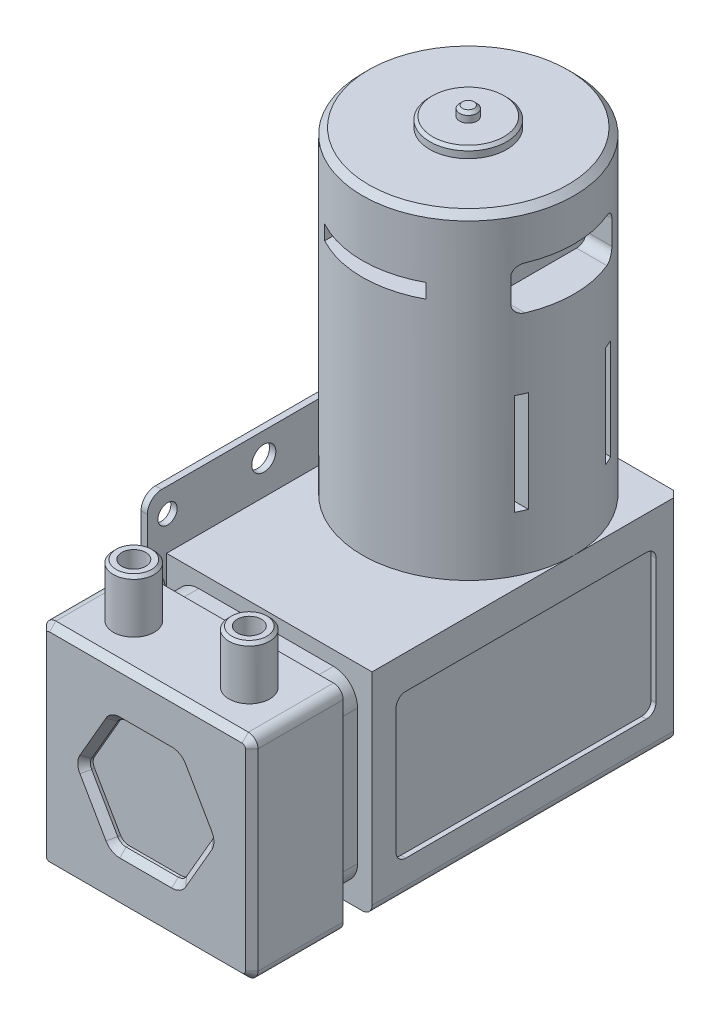
from build123d import *

# Parameters (mm, degrees)
SKETCH_1_W           = 89
SKETCH_1_H           = 44
EXTRUDE_1_DEPTH      = 44
SKETCH_2_R           = 22
EXTRUDE_2_DEPTH      = 66
SKETCH_3_OUTSIDE_W   = 75.636
SKETCH_3_OUTSIDE_H   = 141.636
SKETCH_3_OUTSIDE_W_2 = 38
SKETCH_3_OUTSIDE_H_2 = 38
CUT_EXTRUDE_1_DEPTH  = 6
SKETCH_4_W           = 21
SKETCH_4_H           = 9
SKETCH_4_W_2         = 2
SKETCH_4_H_2         = 21
CUT_EXTRUDE_2_DEPTH  = 8
SKETCH_5_R           = 8
EXTRUDE_3_DEPTH      = 2
SKETCH_6_R           = 1.8
EXTRUDE_4_DEPTH      = 2
SKETCH_7_R           = 4.25
SKETCH_7_R_2         = 2.5
EXTRUDE_5_DEPTH      = 11
SKETCH_8_W           = 54
SKETCH_8_H           = 30
CUT_EXTRUDE_3_DEPTH  = 1
CUT_EXTRUDE_4_DEPTH  = 1.888
SKETCH_10_W          = 21
SKETCH_10_H          = 3
CUT_EXTRUDE_5_DEPTH  = 6
SKETCH_11_W          = 27
SKETCH_11_H          = 22
CUT_EXTRUDE_6_DEPTH  = 1.234
FILLET_1_R           = 5
FILLET_2_R           = 2
CHAMFER_1_SIZE       = 0.6
CHAMFER_2_SIZE       = 1.314
FILLET_3_R           = 2
CHAMFER_3_SIZE       = 1.314
CHAMFER_4_SIZE       = 0.6
SKETCH_12_W          = 46
SKETCH_12_H          = 12
EXTRUDE_6_DEPTH      = 1.314
CUT_EXTRUDE_7_REACH  = 113.267
SKETCH_13_R          = 2
SKETCH_13_R_2        = 2.5
FILLET_4_R           = 10
FILLET_5_R           = 3


with BuildPart() as part:
    # 草图1 → 凸台-拉伸1 (new body)
    with BuildSketch(Plane(origin=(0, 0, 0), x_dir=(0, 0, -1), z_dir=(1, 0, 0))):
        Rectangle(SKETCH_1_W, SKETCH_1_H)
    extrude(amount=EXTRUDE_1_DEPTH)

    # 草图2 → 凸台-拉伸2 (add)
    with BuildSketch(Plane(origin=(0, 22, 0), x_dir=(1, 0, 0), z_dir=(0, 1, 0))):
        with Locations(Location((22, 22.5, 0), (0, 0, 90))):
            Circle(SKETCH_2_R)
    extrude(amount=EXTRUDE_2_DEPTH)

    # 草图3 outside → 切除-拉伸1 (cut)
    with BuildSketch(Plane.XY.offset(25.5)):
        with Locations((22, 33)):
            Rectangle(SKETCH_3_OUTSIDE_W, SKETCH_3_OUTSIDE_H)
        with Locations((22, 0)):
            Rectangle(SKETCH_3_OUTSIDE_W_2, SKETCH_3_OUTSIDE_H_2, mode=Mode.SUBTRACT)
    extrude(amount=-CUT_EXTRUDE_1_DEPTH, mode=Mode.SUBTRACT)

    # 草图4 → 切除-拉伸2 (cut)
    with BuildSketch(Plane(origin=(44, 0, 0), x_dir=(0, 0, -1), z_dir=(1, 0, 0))):
        with Locations((22.5, 73.5)):
            Rectangle(SKETCH_4_W, SKETCH_4_H)
        with Locations((13.5, 44)):
            Rectangle(SKETCH_4_W_2, SKETCH_4_H_2)
        with Locations((31.5, 44)):
            Rectangle(SKETCH_4_W_2, SKETCH_4_H_2)
    cut_extrude_2 = extrude(amount=-CUT_EXTRUDE_2_DEPTH, mode=Mode.SUBTRACT)

    # 镜向1: 切除-拉伸2 across plane
    add(cut_extrude_2.mirror(Plane(origin=(22, 0, 0), x_dir=(0, 0, 1), z_dir=(1, 0, 0))), mode=Mode.SUBTRACT)

    # 草图5 → 凸台-拉伸3 (add)
    with BuildSketch(Plane(origin=(0, 88, 0), x_dir=(1, 0, 0), z_dir=(0, 1, 0))):
        with Locations(Location((22, 22.5, 0), (0, 0, 270))):
            Circle(SKETCH_5_R)
    extrude(amount=EXTRUDE_3_DEPTH)

    # 草图6 → 凸台-拉伸4 (add)
    with BuildSketch(Plane(origin=(0, 90, 0), x_dir=(1, 0, 0), z_dir=(0, 1, 0))):
        with Locations(Location((22, 22.5, 0), (0, 0, 270))):
            Circle(SKETCH_6_R)
    extrude(amount=EXTRUDE_4_DEPTH)

    # 草图7 → 凸台-拉伸5 (add)
    with BuildSketch(Plane(origin=(0, 22, 0), x_dir=(1, 0, 0), z_dir=(0, 1, 0))):
        with Locations(Location((34, -35, 0), (0, 0, 90))):
            Circle(SKETCH_7_R)
        with Locations(Location((34, -35, 0), (0, 0, 270))):
            Circle(SKETCH_7_R_2, mode=Mode.SUBTRACT)
    extrude_5 = extrude(amount=EXTRUDE_5_DEPTH)

    # 镜向2: 凸台-拉伸5 across plane
    add(extrude_5.mirror(Plane(origin=(22, 0, 0), x_dir=(0, 0, 1), z_dir=(1, 0, 0))))

    # 草图8 → 切除-拉伸3 (cut)
    with BuildSketch(Plane(origin=(44, 0, 0), x_dir=(0, 0, -1), z_dir=(1, 0, 0))):
        with Locations((12.5, 0)):
            Rectangle(SKETCH_8_W, SKETCH_8_H)
    cut_extrude_3 = extrude(amount=-CUT_EXTRUDE_3_DEPTH, mode=Mode.SUBTRACT)

    # 镜向3: 切除-拉伸3 across plane
    add(cut_extrude_3.mirror(Plane(origin=(22, 0, 0), x_dir=(0, 0, 1), z_dir=(1, 0, 0))), mode=Mode.SUBTRACT)

    # 草图9 → 切除-拉伸4 (cut)
    with BuildSketch(Plane(origin=(0, 0, -44.5), x_dir=(-1, 0, 0), z_dir=(0, 0, -1))):
        Polygon((-8.86, 0), (-15.43, 11.379573806), (-28.57, 11.379573806), (-35.14, 0), (-28.57, -11.379573806), (-15.43, -11.379573806), align=None)
    cut_extrude_4 = extrude(amount=-CUT_EXTRUDE_4_DEPTH, mode=Mode.SUBTRACT)

    # 镜向4: 切除-拉伸4 across plane
    add(cut_extrude_4.mirror(Plane.XY), mode=Mode.SUBTRACT)

    # 草图10 → 切除-拉伸5 (cut)
    with BuildSketch(Plane(origin=(0, 0, -44.5), x_dir=(-1, 0, 0), z_dir=(0, 0, -1))):
        with Locations((-22, 73.5)):
            Rectangle(SKETCH_10_W, SKETCH_10_H)
    cut_extrude_5 = extrude(amount=-CUT_EXTRUDE_5_DEPTH, mode=Mode.SUBTRACT)

    # 镜向5: 切除-拉伸5 across plane
    add(cut_extrude_5.mirror(Plane(origin=(0, 0, -22.5), x_dir=(1, 0, 0), z_dir=(0, 0, -1))), mode=Mode.SUBTRACT)

    # 草图11 → 切除-拉伸6 (cut)
    with BuildSketch(Plane(origin=(0, -22, 0), x_dir=(-1, 0, 0), z_dir=(0, -1, 0))):
        with Locations((-22, -2.5)):
            Rectangle(SKETCH_11_W, SKETCH_11_H)
        with Locations((-22, 27.5)):
            Rectangle(SKETCH_11_W, SKETCH_11_H)
    extrude(amount=-CUT_EXTRUDE_6_DEPTH, mode=Mode.SUBTRACT)

    # 圆角1
    fillet_1_edges = [part.edges().sort_by_distance(p)[0] for p in [
        (41, -19, 22.5),
        (3, -19, 22.5),
        (3, 19, 22.5),
        (41, 19, 22.5),
    ]]
    fillet(fillet_1_edges, radius=FILLET_1_R)

    # 圆角2
    fillet_2_edges = [part.edges().sort_by_distance(p)[0] for p in [
        (5.333692535, 69, -33),
        (5.333692535, 78, -33),
        (5.333692535, 78, -12),
        (5.333692535, 69, -12),
        (43.5, 15, -39.5),
        (43.5, -15, -39.5),
        (43.5, -15, 14.5),
        (43.5, 15, 14.5),
        (0.5, -15, -39.5),
        (0.5, 15, -39.5),
        (0.5, 15, 14.5),
        (0.5, -15, 14.5),
        (8.86, 0, -43.556),
        (15.43, -11.379573806, -43.556),
        (28.57, -11.379573806, -43.556),
        (35.14, 0, -43.556),
        (28.57, 11.379573806, -43.556),
        (15.43, 11.379573806, -43.556),
        (15.43, -11.379573806, 43.556),
        (8.86, 0, 43.556),
        (15.43, 11.379573806, 43.556),
        (28.57, 11.379573806, 43.556),
        (35.14, 0, 43.556),
        (28.57, -11.379573806, 43.556),
        (35.5, -21.383, 13.5),
        (35.5, -21.383, -8.5),
        (8.5, -21.383, -8.5),
        (8.5, -21.383, 13.5),
        (35.5, -21.383, -16.5),
        (35.5, -21.383, -38.5),
        (8.5, -21.383, -38.5),
        (8.5, -21.383, -16.5),
        (38.666307465, 78, -33),
        (38.666307465, 69, -33),
        (38.666307465, 69, -12),
        (38.666307465, 78, -12),
    ]]
    fillet(fillet_2_edges, radius=FILLET_2_R)

    # 倒角1
    chamfer_1_edges = [part.edges().sort_by_distance(p)[0] for p in [
        (34, 33, 39.25),
        (10, 33, 39.25),
    ]]
    chamfer(chamfer_1_edges, length=CHAMFER_1_SIZE)

    # 倒角2
    chamfer_2_edges = [part.edges().sort_by_distance(p)[0] for p in [
        (22, 88, -0.5),
    ]]
    chamfer(chamfer_2_edges, length=CHAMFER_2_SIZE)

    # 圆角3
    fillet_3_edges = [part.edges().sort_by_distance(p)[0] for p in [
        (44, -22, 35),
        (0, -22, -12.5),
        (0, 22, 35),
        (44, 22, 35),
        (44, -22, -12.5),
        (0, -22, 35),
    ]]
    fillet(fillet_3_edges, radius=FILLET_3_R)

    # 倒角3
    chamfer_3_edges = [part.edges().sort_by_distance(p)[0] for p in [
        (22, -11.379573806, 44.5),
        (12.145, -5.689786903, 44.5),
        (31.855, 5.689786903, 44.5),
        (31.855, -5.689786903, 44.5),
        (22, 11.379573806, 44.5),
        (12.145, 5.689786903, 44.5),
        (22, 11.379573806, -44.5),
        (12.145, 5.689786903, -44.5),
        (31.855, 5.689786903, -44.5),
        (31.855, -5.689786903, -44.5),
        (22, -11.379573806, -44.5),
        (12.145, -5.689786903, -44.5),
        (15.584700538, -11.111624613, 44.5),
        (34.830598923, 0, 44.5),
        (28.415299462, 11.111624613, 44.5),
        (15.584700538, 11.111624613, 44.5),
        (9.169401077, 0, 44.5),
        (28.415299462, -11.111624613, 44.5),
        (15.584700538, 11.111624613, -44.5),
        (28.415299462, 11.111624613, -44.5),
        (34.830598923, 0, -44.5),
        (28.415299462, -11.111624613, -44.5),
        (15.584700538, -11.111624613, -44.5),
        (9.169401077, 0, -44.5),
        (22, -22, -44.5),
        (0, 1, -44.5),
        (44, 1, -44.5),
        (43.414213562, -21.414213562, -44.5),
        (0.585786438, -21.414213562, -44.5),
        (22, 22, 44.5),
        (0, 0, 44.5),
        (22, -22, 44.5),
        (44, 0, 44.5),
        (43.414213562, 21.414213562, 44.5),
        (43.414213562, -21.414213562, 44.5),
        (0.585786438, -21.414213562, 44.5),
        (0.585786438, 21.414213562, 44.5),
    ]]
    chamfer(chamfer_3_edges, length=CHAMFER_3_SIZE)

    # 倒角4
    chamfer_4_edges = [part.edges().sort_by_distance(p)[0] for p in [
        (22, 90, -30.5),
        (22, 92, -24.3),
    ]]
    chamfer(chamfer_4_edges, length=CHAMFER_4_SIZE)

    # 草图12 → 凸台-拉伸6 (add)
    with BuildSketch(Plane.ZY):
        with Locations((0.5, 28)):
            Rectangle(SKETCH_12_W, SKETCH_12_H)
    extrude(amount=-EXTRUDE_6_DEPTH)

    # 草图13 → 切除-拉伸7 (cut, up to next)
    with BuildSketch(Plane.ZY, mode=Mode.PRIVATE) as cut_extrude_7_sk1:
        with Locations((19.3, 29)):
            Circle(SKETCH_13_R)
    cut_extrude_7_tool1 = extrude(cut_extrude_7_sk1.sketch, amount=-CUT_EXTRUDE_7_REACH, mode=Mode.PRIVATE) & part.part
    # 草图13 → 切除-拉伸7 (cut, up to next)
    with BuildSketch(Plane.ZY, mode=Mode.PRIVATE) as cut_extrude_7_sk2:
        with Locations((-0.7, 29)):
            Circle(SKETCH_13_R_2)
    cut_extrude_7_tool2 = extrude(cut_extrude_7_sk2.sketch, amount=-CUT_EXTRUDE_7_REACH, mode=Mode.PRIVATE) & part.part
    add(cut_extrude_7_tool1.solids().sort_by_distance((0, 29, 19.3))[0], mode=Mode.SUBTRACT)
    add(cut_extrude_7_tool2.solids().sort_by_distance((0, 29, -0.7))[0], mode=Mode.SUBTRACT)

    # 圆角4
    # the kernel refuses this fillet: 10 mm, written as the material it adds along each edge
    with BuildSketch(Plane(origin=(0, 22, 19.5), x_dir=(0, 0, 1), z_dir=(1, 0, 0))) as fillet_4_piece_1:
        with BuildLine():
            CenterArc((10, 8), FILLET_4_R, 180, 53.130102354)
            Line((0, 8), (0, 0))
            Line((0, 0), (4, 0))
        make_face()
    extrude(amount=1.314)

    # 圆角5
    fillet_5_edges = [part.edges().sort_by_distance(p)[0] for p in [
        (0.657, 34, 23.5),
        (0.657, 22, 23.5),
    ]]
    fillet(fillet_5_edges, radius=FILLET_5_R)


solid = part.part
